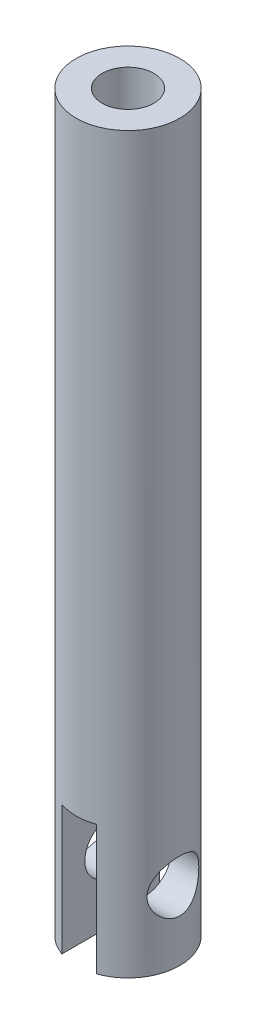
from build123d import *

# Parameters (mm, degrees)
SKETCH1_R               = 6
SKETCH1_R_2             = 1.5
BOSS_EXTRUDE1_DEPTH     = 75
SKETCH2_R               = 1.5
CUT_EXTRUDE1_DEPTH      = 75
BOSS_EXTRUDE2_START     = 10
SKETCH4_R               = 6
SKETCH4_R_2             = 1.5
BOSS_EXTRUDE2_DEPTH     = 10
SKETCH5_W               = 4
SKETCH5_H               = 14.413625946
CUT_EXTRUDE2_DEPTH      = 15
CUT_EXTRUDE4_DEPTH      = 15
CUT_EXTRUDE4_DEPTH_BACK = 15
SKETCH7_R               = 3
SKETCH8_R               = 3
CUT_EXTRUDE5_DEPTH      = 14


with BuildPart() as part:
    # Sketch1 → Boss-Extrude1 (new body)
    with BuildSketch(Plane(origin=(0, 0, 0), x_dir=(1, 0, 0), z_dir=(0, 1, 0))):
        Circle(SKETCH1_R)
        Circle(SKETCH1_R_2, mode=Mode.SUBTRACT)
    extrude(amount=BOSS_EXTRUDE1_DEPTH)

    # Sketch2 → Cut-Extrude1 (cut)
    with BuildSketch(Plane.XY):
        with Locations((0, 23.5)):
            Circle(SKETCH2_R)
        with Locations((0, 54)):
            Circle(SKETCH2_R)
    extrude(amount=-CUT_EXTRUDE1_DEPTH, mode=Mode.SUBTRACT)

    # Sketch4 → Boss-Extrude2 (add)
    with BuildSketch(Plane.XZ.offset(BOSS_EXTRUDE2_START)):
        Circle(SKETCH4_R)
        Circle(SKETCH4_R_2, mode=Mode.SUBTRACT)
    extrude(amount=-BOSS_EXTRUDE2_DEPTH)

    # Sketch5 → Cut-Extrude2 (cut)
    with BuildSketch(Plane.XZ.offset(10)):
        Rectangle(SKETCH5_W, SKETCH5_H)
    extrude(amount=-CUT_EXTRUDE2_DEPTH, mode=Mode.SUBTRACT)

    # Sketch7 → Cut-Extrude4 (cut, two sides: drawn at the far end of the back side and taken through both)
    with BuildSketch(Plane(origin=(-2, 0, 0), x_dir=(0, 0, -1), z_dir=(1, 0, 0)).offset(-CUT_EXTRUDE4_DEPTH_BACK)):
        with Locations((0, -2)):
            Circle(SKETCH7_R)
    extrude(amount=CUT_EXTRUDE4_DEPTH + CUT_EXTRUDE4_DEPTH_BACK, mode=Mode.SUBTRACT)

    # Sketch8 → Cut-Extrude5 (cut)
    with BuildSketch(Plane(origin=(0, 75, 0), x_dir=(1, 0, 0), z_dir=(0, 1, 0))):
        Circle(SKETCH8_R)
    extrude(amount=-CUT_EXTRUDE5_DEPTH, mode=Mode.SUBTRACT)


solid = part.part
